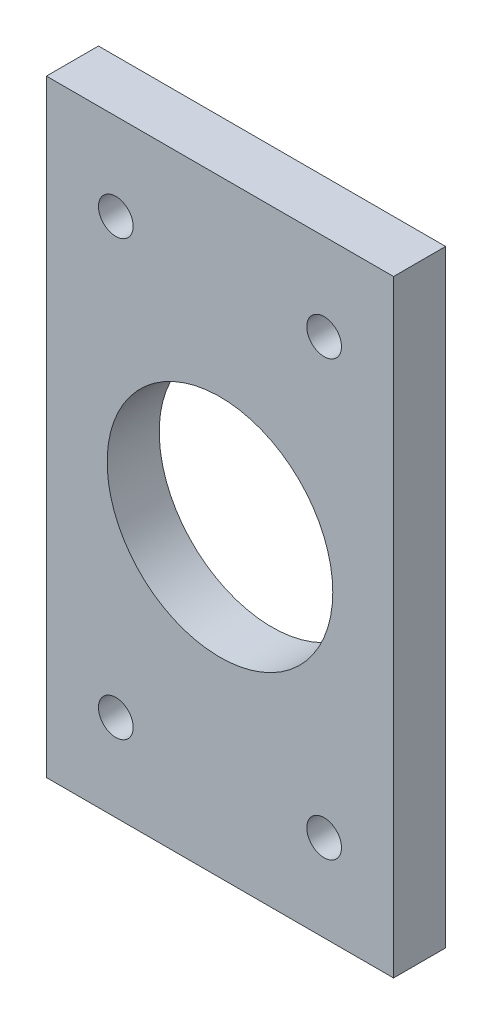
from build123d import *

# Parameters (mm, degrees)
SKETCH_1_W          = 40
SKETCH_1_H          = 70
SKETCH_1_R          = 13
EXTRUDE_1_DEPTH     = 6
SKETCH_2_R          = 2
CUT_EXTRUDE_1_DEPTH = 10


with BuildPart() as part:
    # 草图1 → 凸台-拉伸1 (new body)
    with BuildSketch(Plane.XY):
        with Locations((-20, 35)):
            Rectangle(SKETCH_1_W, SKETCH_1_H)
        with Locations((-20, 35)):
            Circle(SKETCH_1_R, mode=Mode.SUBTRACT)
    extrude(amount=EXTRUDE_1_DEPTH)

    # 草图2 → 切除-拉伸1 (cut)
    with BuildSketch(Plane.XY.offset(6)):
        with Locations((-32, 60)):
            Circle(SKETCH_2_R)
        with Locations((-8, 60)):
            Circle(SKETCH_2_R)
    cut_extrude_1 = extrude(amount=-CUT_EXTRUDE_1_DEPTH, mode=Mode.SUBTRACT)

    # 镜向1: 切除-拉伸1 across plane
    add(cut_extrude_1.mirror(Plane.ZX.offset(35)), mode=Mode.SUBTRACT)


solid = part.part
